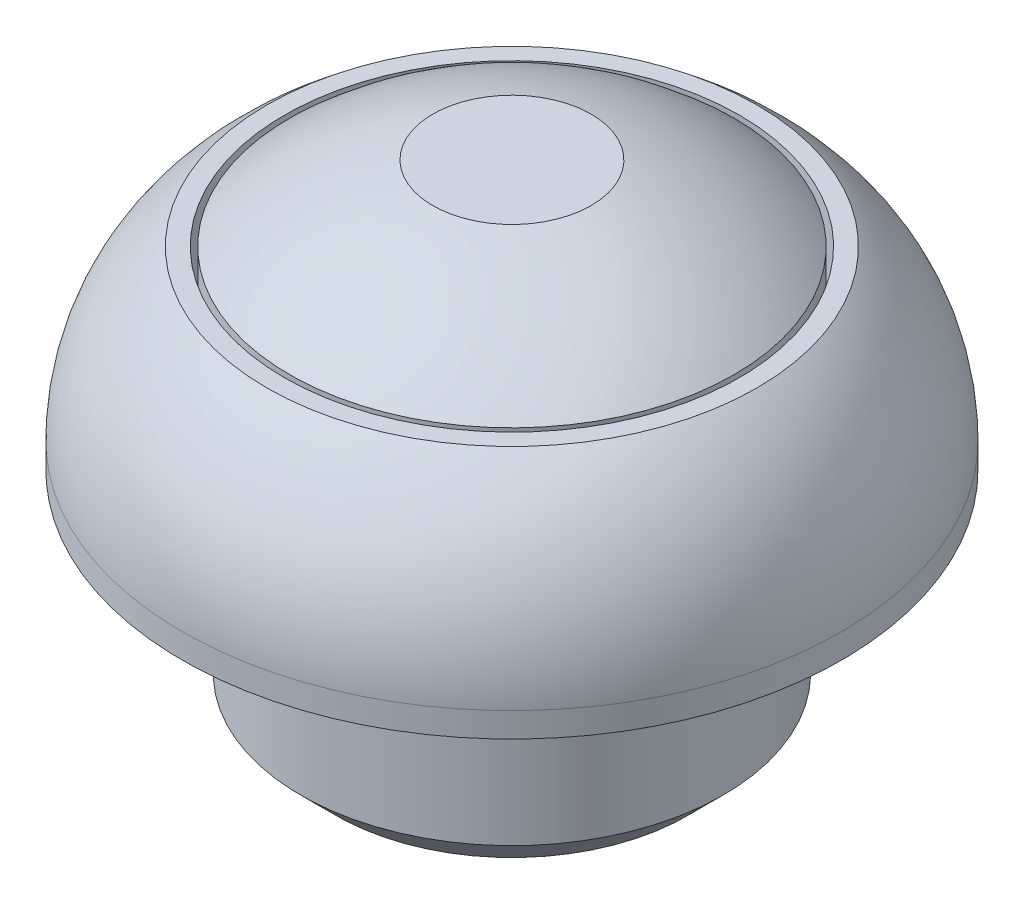
from build123d import *

# Parameters (mm, degrees)
CHAMFER1_SIZE = 1


with BuildPart() as part:
    # Sketch1 → Revolve1 (revolve)
    with BuildSketch(Plane.XY):
        with BuildLine():
            Line((0, 0), (0, 6.7))
            Line((0, 6.7), (6.461893535, 6.7))
            Line((6.461893535, 6.7), (6.461893535, 11.5))
            Line((6.461893535, 11.5), (6.961893535, 11.5))
            ThreePointArc((6.961893535, 11.5), (8.728456681, 9.383281573), (9.361893535, 6.7))
            Line((9.361893535, 6.7), (9.361893535, 6))
            Line((9.361893535, 6), (6, 6))
            Line((6, 6), (6, 0))
            Line((6, 0), (0, 0))
        make_face()
        with BuildLine():
            Line((0, 7.5), (6.311893535, 7.5))
            Line((6.311893535, 7.5), (6.311893535, 11.5))
            ThreePointArc((6.311893535, 11.5), (4.411396457, 12.813654455), (2.25, 13.629707471))
            Line((2.25, 13.629707471), (0, 13.629707471))
            Line((0, 13.629707471), (0, 7.5))
        make_face()
    revolve(axis=Axis((0, 0, 0), (0, 1, 0)))

    # Chamfer1
    chamfer1_edges = [part.edges().sort_by_distance(p)[0] for p in [
        (-6, 0, 0),
    ]]
    chamfer(chamfer1_edges, length=CHAMFER1_SIZE)


solid = part.part
